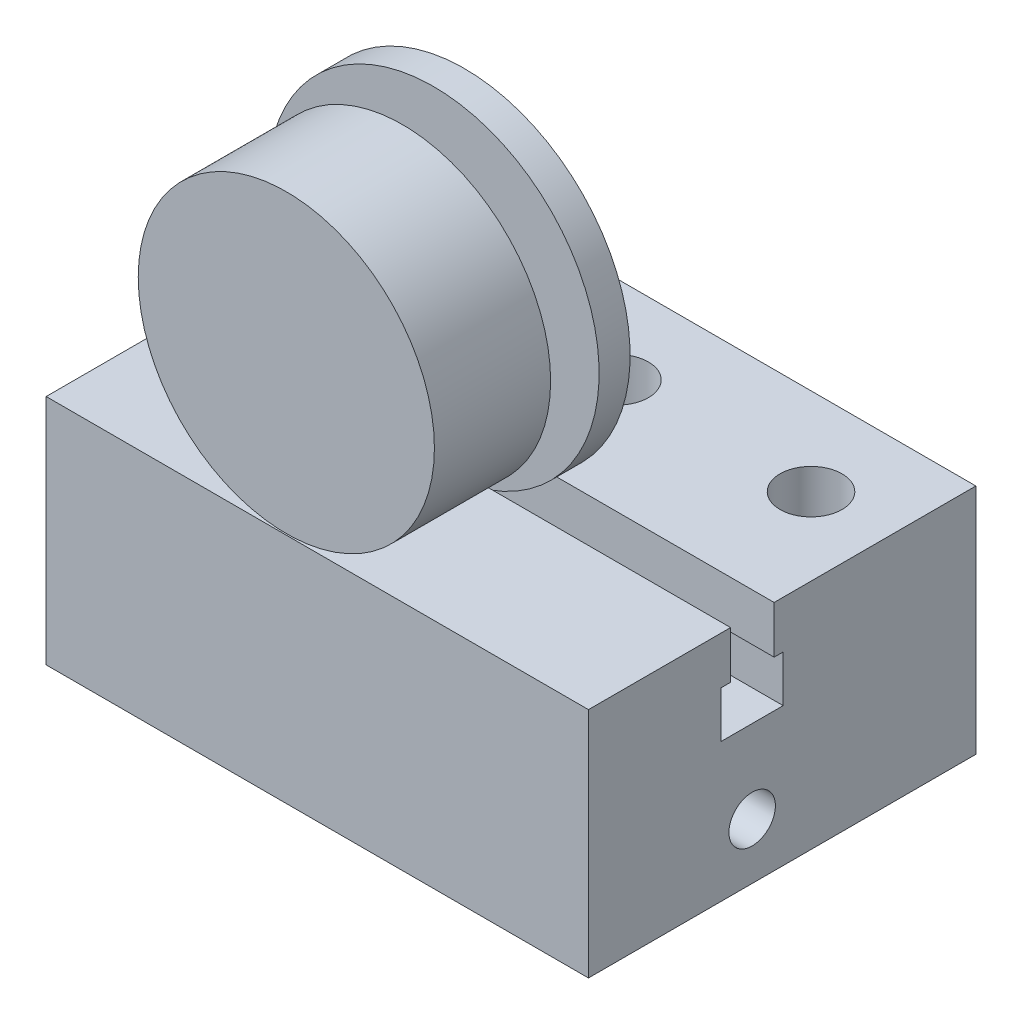
from build123d import *

# Parameters (mm, degrees)
SKETCH1_W           = 70
SKETCH1_H           = 50
SKETCH1_R           = 4
BOSS_EXTRUDE1_DEPTH = 30
SKETCH2_R           = 3
CUT_EXTRUDE1_DEPTH  = 71
SKETCH6_R           = 19.115114925
BOSS_EXTRUDE3_DEPTH = 15
SKETCH7_R           = 2
BOSS_EXTRUDE4_DEPTH = 4
SKETCH8_R           = 21.374545816
BOSS_EXTRUDE5_DEPTH = 4


with BuildPart() as part:
    # Sketch1 → Boss-Extrude1 (new body)
    with BuildSketch(Plane(origin=(0, 0, 0), x_dir=(1, 0, 0), z_dir=(0, 1, 0))):
        with Locations((45.25504703, 19.741860607)):
            Rectangle(SKETCH1_W, SKETCH1_H)
        with Locations((45.25504703, 33.47585277)):
            Circle(SKETCH1_R, mode=Mode.SUBTRACT)
        with Locations((70.25504538, 33.466769909)):
            Circle(SKETCH1_R, mode=Mode.SUBTRACT)
        with Locations((20.255048319, 33.467826551)):
            Circle(SKETCH1_R, mode=Mode.SUBTRACT)
    extrude(amount=BOSS_EXTRUDE1_DEPTH)

    # Sketch2 → Cut-Extrude1 (cut)
    with BuildSketch(Plane.ZY.offset(-10.25504703)):
        with Locations((-15.87058853, 7.198699216)):
            Circle(SKETCH2_R)
        Polygon((-19.87058853, 17.881027255), (-11.87058853, 17.881027255), (-11.87058853, 23.881027255), (-13.086657096, 23.881027255), (-13.086657096, 30), (-18.703311227, 30), (-18.703311227, 23.881027255), (-19.87058853, 23.881027255), align=None)
    extrude(amount=-CUT_EXTRUDE1_DEPTH, mode=Mode.SUBTRACT)


with BuildPart() as body_2:
    # Sketch6 → Boss-Extrude3 (new body)
    with BuildSketch(Plane.XY.offset(5.258139393)):
        with Locations((41.25504703, 49.284939292)):
            Circle(SKETCH6_R)
    extrude(amount=-BOSS_EXTRUDE3_DEPTH)

    # Sketch7 → Boss-Extrude4 (add)
    with BuildSketch(Plane(origin=(0, 0, -9.741860607), x_dir=(-1, 0, 0), z_dir=(0, 0, -1))):
        with Locations((-41.25504703, 49.284939292)):
            Circle(SKETCH7_R)
    extrude(amount=BOSS_EXTRUDE4_DEPTH)

    # Sketch8 → Boss-Extrude5 (add)
    with BuildSketch(Plane(origin=(0, 0, -13.741860607), x_dir=(-1, 0, 0), z_dir=(0, 0, -1))):
        with Locations((-41.25504703, 49.284939292)):
            Circle(SKETCH8_R)
    extrude(amount=BOSS_EXTRUDE5_DEPTH)


solid = Compound([part.part, body_2.part])
